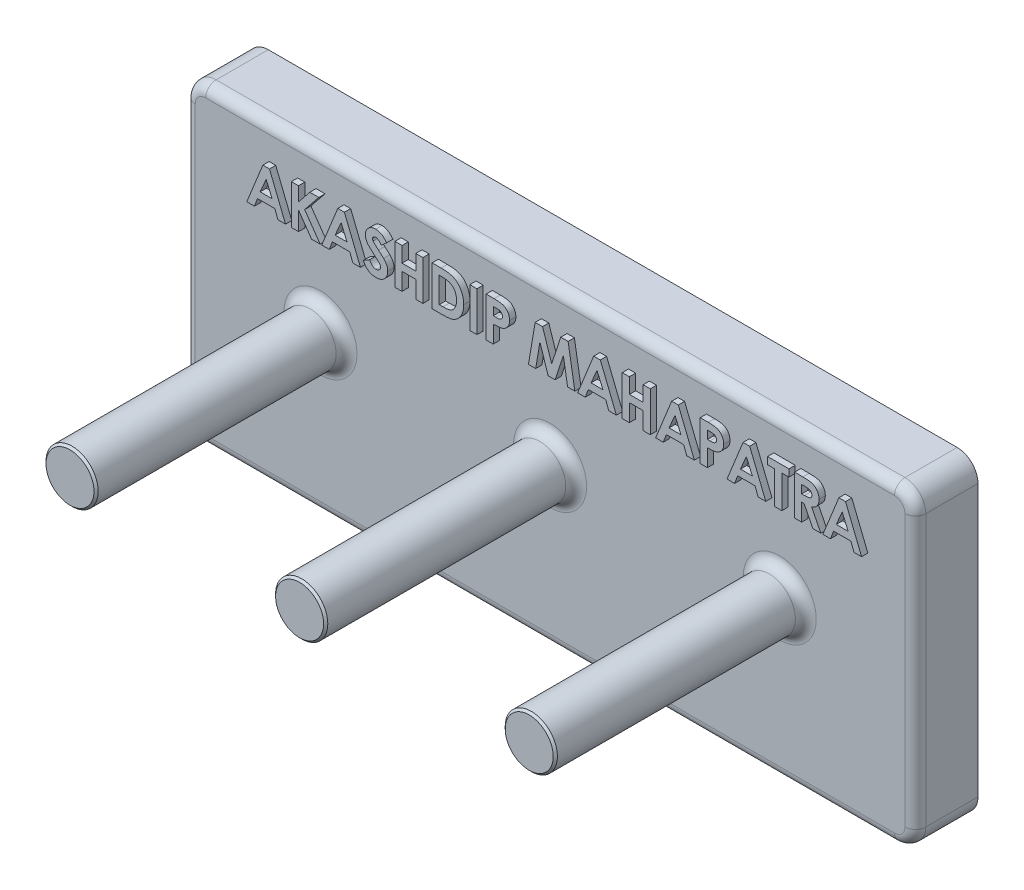
from build123d import *

# Parameters (mm, degrees)
SKETCH1_R           = 12.5
BOSS_EXTRUDE1_DEPTH = 30
SKETCH1_2_R         = 12.5
BOSS_EXTRUDE2_DEPTH = 150
FILLET1_R           = 5
CHAMFER1_SIZE       = 1
WRAP1_OUTLINE_W     = 3.419230769
WRAP1_OUTLINE_H     = 19.05
WRAP1_DEPTH         = 3


# Read off the part's stored shape, not the designer's step: Wrap1
with BuildPart() as part:
    # Sketch1 → Boss-Extrude1 (new body)
    with BuildSketch(Plane.XY):
        with BuildLine():
            Line((-165, 75), (165, 75))
            ThreePointArc((165, 75), (172.071067812, 72.071067812), (175, 65))
            Line((175, 65), (175, -65))
            ThreePointArc((175, -65), (172.071067812, -72.071067812), (165, -75))
            Line((165, -75), (-165, -75))
            ThreePointArc((-165, -75), (-172.071067812, -72.071067812), (-175, -65))
            Line((-175, -65), (-175, 65))
            ThreePointArc((-175, 65), (-172.071067812, 72.071067812), (-165, 75))
        make_face()
        with Locations((-110, 0)):
            Circle(SKETCH1_R, mode=Mode.SUBTRACT)
        Circle(SKETCH1_R, mode=Mode.SUBTRACT)
        with Locations((110, 0)):
            Circle(SKETCH1_R, mode=Mode.SUBTRACT)
    extrude(amount=BOSS_EXTRUDE1_DEPTH)

    # Sketch1<2> → Boss-Extrude2 (add)
    with BuildSketch(Plane.XY):
        with Locations((-110, 0)):
            Circle(SKETCH1_2_R)
        Circle(SKETCH1_2_R)
        with Locations((110, 0)):
            Circle(SKETCH1_2_R)
    extrude(amount=BOSS_EXTRUDE2_DEPTH)

    # Fillet1
    fillet1_edges = [part.edges().sort_by_distance(p)[0] for p in [
        (-172.071067812, 72.071067812, 30),
        (-175, 0, 30),
        (-172.071067812, -72.071067812, 30),
        (-122.5, 0, 30),
        (0, -75, 30),
        (-12.5, 0, 30),
        (172.071067812, -72.071067812, 30),
        (97.5, 0, 30),
        (175, 0, 30),
        (172.071067812, 72.071067812, 30),
        (0, 75, 30),
    ]]
    fillet(fillet1_edges, radius=FILLET1_R)

    # Chamfer1
    chamfer1_edges = [part.edges().sort_by_distance(p)[0] for p in [
        (-122.5, 0, 150),
        (-12.5, 0, 150),
        (97.5, 0, 150),
    ]]
    chamfer(chamfer1_edges, length=CHAMFER1_SIZE)

    # Wrap1 outline → Wrap1 (add)
    # profile 1 of 17: a face of its own
    with BuildSketch(Plane.XY.offset(30)):
        with BuildLine():
            add(Edge.make_bspline(
                [(-77.825171456, 53.916183611), (-77.934693413, 54.070675718), (-78.144960298, 54.367279018), (-78.485780987, 54.764437829), (-78.825062696, 55.10324385), (-79.165948663, 55.382281708), (-79.511460373, 55.599856039), (-79.860998066, 55.753901068), (-80.212580117, 55.851828956), (-80.448788984, 55.864023334), (-80.565135398, 55.870029764)],
                knots=[0, 0, 0, 0, 0.162420307, 0.31182434, 0.448432767, 0.573381197, 0.689077147, 0.797572901, 0.900293043, 1, 1, 1, 1], degree=3))
            Line((-77.825171456, 53.916183611), (-75.268380591, 56.255456447))
            add(Edge.make_bspline(
                [(-80.526974341, 59.289260534), (-80.302522437, 59.281049605), (-79.855390373, 59.264692561), (-79.194292722, 59.136785826), (-78.548560176, 58.935639012), (-78.028216789, 58.692977511), (-77.614189269, 58.4579112), (-77.29687585, 58.241491751), (-76.973992366, 57.993571641), (-76.642934963, 57.713369608), (-76.3098552, 57.395606277), (-75.965282025, 57.047846255), (-75.61391067, 56.667084082), (-75.385575, 56.395069351), (-75.268380591, 56.255456447)],
                knots=[0, 0, 0, 0, 0.10691022, 0.212976528, 0.319776676, 0.428556273, 0.485856803, 0.546558687, 0.611431498, 0.67982091, 0.753158505, 0.830752869, 0.913133075, 1, 1, 1, 1], degree=3))
            add(Edge.make_bspline(
                [(-85.526072898, 54.45807063), (-85.521940711, 54.62116651), (-85.513799859, 54.942482914), (-85.441182199, 55.414931869), (-85.332652339, 55.870805414), (-85.175035825, 56.308440314), (-84.97046862, 56.727288414), (-84.722029697, 57.129400152), (-84.425861269, 57.511074582), (-84.092099444, 57.872058682), (-83.724379366, 58.201957069), (-83.331423733, 58.493125451), (-82.915456707, 58.739050501), (-82.479022964, 58.943063187), (-82.019418107, 59.099221938), (-81.540028022, 59.209915044), (-81.040165113, 59.275751774), (-80.700169152, 59.284701514), (-80.526974341, 59.289260534)],
                knots=[0, 0, 0, 0, 0.06317288, 0.12445736, 0.184840915, 0.244566821, 0.304319173, 0.365199786, 0.427420983, 0.491261689, 0.555499002, 0.618604518, 0.680494764, 0.742473305, 0.804990665, 0.868251971, 0.932887217, 1, 1, 1, 1], degree=3))
            add(Edge.make_bspline(
                [(-80.725411841, 47.772253322), (-80.967886154, 47.977409842), (-81.433267752, 48.371167301), (-82.090910995, 48.952734672), (-82.683506441, 49.496262669), (-83.205935799, 50.008470485), (-83.664855629, 50.47989883), (-84.057157926, 50.914376825), (-84.37853307, 51.315255874), (-84.716711112, 51.790070281), (-85.038047866, 52.36866426), (-85.315774009, 53.064779892), (-85.495951009, 53.760807197), (-85.516137336, 54.228081593), (-85.526072898, 54.45807063)],
                knots=[0, 0, 0, 0, 0.112124581, 0.215201009, 0.309902452, 0.395959096, 0.473447494, 0.542140328, 0.602523333, 0.654726333, 0.747804055, 0.835278417, 0.918925243, 1, 1, 1, 1], degree=3))
            add(Edge.make_bspline(
                [(-78.199149821, 44.486586255), (-78.205422389, 44.595289709), (-78.21816451, 44.816110371), (-78.312019048, 45.144435186), (-78.458742317, 45.472610685), (-78.632326291, 45.741789109), (-78.808969721, 45.967164906), (-78.977880681, 46.162442839), (-79.183569549, 46.378190768), (-79.425514787, 46.614680088), (-79.700519668, 46.873992674), (-80.008815848, 47.156103134), (-80.353933644, 47.45852641), (-80.597863584, 47.664534158), (-80.725411841, 47.772253322)],
                knots=[0, 0, 0, 0, 0.076346606, 0.155090822, 0.238351561, 0.32840414, 0.37938386, 0.439617644, 0.509831416, 0.588874645, 0.677436354, 0.77554672, 0.882635872, 1, 1, 1, 1], degree=3))
            add(Edge.make_bspline(
                [(-80.37433011, 42.681568226), (-80.226072065, 42.687564162), (-79.938429864, 42.699197152), (-79.527857431, 42.806647573), (-79.151429079, 42.975352617), (-78.826047191, 43.216071449), (-78.550534324, 43.493897569), (-78.347190013, 43.80299183), (-78.219447746, 44.13742436), (-78.205942291, 44.369743194), (-78.199149821, 44.486586255)],
                knots=[0, 0, 0, 0, 0.141985893, 0.275473311, 0.404345843, 0.535429711, 0.661427401, 0.77786684, 0.888279749, 1, 1, 1, 1], degree=3))
            add(Edge.make_bspline(
                [(-83.495904629, 45.123875918), (-83.384876817, 44.930883015), (-83.172027012, 44.560899124), (-82.811333119, 44.063778875), (-82.441820639, 43.638077669), (-82.054946775, 43.291319805), (-81.655415769, 43.018868682), (-81.241297793, 42.824156208), (-80.812301896, 42.703629407), (-80.52008938, 42.688910301), (-80.37433011, 42.681568226)],
                knots=[0, 0, 0, 0, 0.160457921, 0.307611547, 0.442138888, 0.566229194, 0.681222208, 0.789558005, 0.895028892, 1, 1, 1, 1], degree=3))
            Line((-83.495904629, 45.123875918), (-86.502995975, 43.318857889))
            add(Edge.make_bspline(
                [(-80.5002616, 39.262337457), (-80.663189489, 39.265227906), (-80.985880148, 39.270952653), (-81.461477394, 39.31769045), (-81.920720298, 39.39312028), (-82.363091565, 39.50123376), (-82.790584155, 39.638228203), (-83.203215623, 39.805561666), (-83.59813744, 40.005827757), (-83.978337769, 40.234908207), (-84.341968369, 40.500900786), (-84.693627205, 40.798367361), (-85.029821267, 41.131883102), (-85.352165228, 41.500659256), (-85.658596642, 41.90574011), (-85.959146107, 42.341484163), (-86.240456301, 42.815978233), (-86.414234122, 43.148839661), (-86.502995975, 43.318857889)],
                knots=[0, 0, 0, 0, 0.063551482, 0.125868382, 0.18624025, 0.244976651, 0.303357688, 0.361230317, 0.418489049, 0.475936712, 0.534203744, 0.594059429, 0.655468694, 0.718771685, 0.784974607, 0.853522316, 0.925182451, 1, 1, 1, 1], degree=3))
            add(Edge.make_bspline(
                [(-74.779919052, 44.685023755), (-74.78332903, 44.492627347), (-74.790019535, 44.115138433), (-74.871965383, 43.562739638), (-74.988815353, 43.034070016), (-75.169485906, 42.534882241), (-75.389686105, 42.056982298), (-75.665738858, 41.607814347), (-75.989924965, 41.182832626), (-76.361492019, 40.789634203), (-76.772489302, 40.432833888), (-77.213322949, 40.11520182), (-77.688303653, 39.852956089), (-78.193373254, 39.637015435), (-78.728261398, 39.470695056), (-79.292330874, 39.347768795), (-79.886444464, 39.273990391), (-80.292707898, 39.266277734), (-80.5002616, 39.262337457)],
                knots=[0, 0, 0, 0, 0.065200875, 0.127926544, 0.18904691, 0.248543693, 0.307607127, 0.36724766, 0.426963056, 0.488617128, 0.550391855, 0.611330734, 0.672556085, 0.734024191, 0.797340621, 0.862249627, 0.929625466, 1, 1, 1, 1], degree=3))
            add(Edge.make_bspline(
                [(-76.749029629, 49.054464861), (-76.580847605, 48.872455891), (-76.257542692, 48.522570733), (-75.837360277, 47.980358776), (-75.491536558, 47.451049345), (-75.224000772, 46.924682627), (-75.021946985, 46.393664197), (-74.879496389, 45.844970857), (-74.794181779, 45.272869106), (-74.784709866, 44.8824795), (-74.779919052, 44.685023755)],
                knots=[0, 0, 0, 0, 0.150833097, 0.289954183, 0.417138648, 0.535255184, 0.648751095, 0.762405462, 0.879826701, 1, 1, 1, 1], degree=3))
            add(Edge.make_bspline(
                [(-79.202785639, 51.252541784), (-79.042538941, 51.11385635), (-78.738424002, 50.850660209), (-78.305728834, 50.477095547), (-77.925461847, 50.141008528), (-77.592083417, 49.847443101), (-77.310647237, 49.593319092), (-77.079970148, 49.377421791), (-76.897234819, 49.203954322), (-76.793360485, 49.099179865), (-76.749029629, 49.054464861)],
                knots=[0, 0, 0, 0, 0.192952702, 0.366184141, 0.520457298, 0.655012135, 0.770624226, 0.865677185, 0.942674527, 1, 1, 1, 1], degree=3))
            add(Edge.make_bspline(
                [(-81.79010535, 53.710113899), (-81.746294636, 53.654804936), (-81.645448157, 53.527491009), (-81.453154577, 53.325845593), (-81.211674226, 53.078812309), (-80.91171443, 52.794885906), (-80.565727347, 52.463855282), (-80.157676028, 52.098733375), (-79.699305969, 51.688212786), (-79.373507151, 51.402341113), (-79.202785639, 51.252541784)],
                knots=[0, 0, 0, 0, 0.059234189, 0.136349281, 0.233805212, 0.349411224, 0.48317915, 0.635966856, 0.809243356, 1, 1, 1, 1], degree=3))
            add(Edge.make_bspline(
                [(-82.106842129, 54.622163178), (-82.103476826, 54.542871703), (-82.096699574, 54.383189691), (-82.031240542, 54.149155816), (-81.932575089, 53.920477477), (-81.838296221, 53.78127009), (-81.79010535, 53.710113899)],
                knots=[0, 0, 0, 0, 0.241881375, 0.487115475, 0.73783784, 1, 1, 1, 1], degree=3))
            add(Edge.make_bspline(
                [(-80.565135398, 55.870029764), (-80.673659997, 55.866223814), (-80.883192483, 55.858875525), (-81.181896588, 55.785834075), (-81.447090346, 55.65977526), (-81.67851494, 55.494942753), (-81.861837362, 55.296357797), (-82.0082061, 55.088093239), (-82.090623999, 54.858216267), (-82.101471816, 54.700327489), (-82.106842129, 54.622163178)],
                knots=[0, 0, 0, 0, 0.148126258, 0.285992887, 0.416634394, 0.547379946, 0.671582838, 0.784400739, 0.893265576, 1, 1, 1, 1], degree=3))
        make_face()
    # profile 2 of 17: a face of its own
    with BuildSketch(Plane.XY.offset(30)):
        with BuildLine():
            add(Edge.make_bspline(
                [(-49.223458716, 58.800798995), (-48.887570673, 58.798451023), (-48.23829529, 58.793912366), (-47.297623708, 58.742772615), (-46.42291884, 58.664123308), (-45.613616833, 58.555926933), (-44.871376887, 58.412753501), (-44.197156105, 58.233170491), (-43.588691642, 58.025871782), (-43.03931181, 57.781942786), (-42.537780864, 57.497545802), (-42.061561225, 57.180750394), (-41.611587938, 56.819951421), (-41.18154634, 56.422109413), (-40.776986209, 55.979945975), (-40.391170169, 55.500784933), (-40.033544749, 54.977677792), (-39.693299704, 54.423167012), (-39.385593336, 53.834902629), (-39.117200344, 53.217891827), (-38.892365907, 52.576105299), (-38.709676284, 51.908859069), (-38.56405157, 51.218368191), (-38.462160893, 50.503239319), (-38.399171061, 49.764134543), (-38.392781269, 49.263206946), (-38.389534437, 49.008671591)],
                knots=[0, 0, 0, 0, 0.060148162, 0.116267077, 0.168653955, 0.217398969, 0.262433523, 0.303932701, 0.342259967, 0.377441339, 0.411406099, 0.445398351, 0.479766387, 0.514584482, 0.550213651, 0.587000908, 0.624662987, 0.663615456, 0.703456428, 0.743450162, 0.784013386, 0.825132536, 0.867264663, 0.910306473, 0.954424205, 1, 1, 1, 1], degree=3))
            Line((-49.223458716, 58.800798995), (-53.531842129, 58.800798995))
            Line((-53.531842129, 58.800798995), (-53.531842129, 39.750798995))
            Line((-53.531842129, 39.750798995), (-49.158584918, 39.750798995))
            add(Edge.make_bspline(
                [(-38.389534437, 49.008671591), (-38.398036397, 48.649505637), (-38.414773002, 47.942466433), (-38.555752819, 46.904894546), (-38.783764918, 45.910278406), (-39.104370638, 44.966398288), (-39.501835908, 44.081659581), (-39.97665268, 43.271664283), (-40.521859035, 42.540760037), (-41.131103287, 41.892586148), (-41.79076643, 41.335471906), (-42.476289459, 40.858344328), (-43.194350615, 40.482089419), (-43.827062845, 40.243487541), (-44.375703284, 40.095097817), (-44.857403654, 40.00739806), (-45.404566125, 39.926972095), (-46.022292512, 39.864820638), (-46.707872982, 39.809396813), (-47.464040268, 39.779281663), (-48.288346118, 39.754260444), (-48.860904469, 39.751983045), (-49.158584918, 39.750798995)],
                knots=[0, 0, 0, 0, 0.065772947, 0.129477895, 0.191430088, 0.252445668, 0.311786958, 0.36881755, 0.424091518, 0.478492106, 0.531393744, 0.58200397, 0.631201271, 0.679503008, 0.705561374, 0.735221723, 0.769132486, 0.80685832, 0.848929771, 0.895116661, 0.945469804, 1, 1, 1, 1], degree=3))
        make_face()
        with BuildLine():
            add(Edge.make_bspline(
                [(-48.32667386, 43.170029764), (-48.114174725, 43.170419151), (-47.705468148, 43.171168071), (-47.115388365, 43.20683976), (-46.569714185, 43.2426443), (-46.069947722, 43.310602514), (-45.61245183, 43.386303181), (-45.203511304, 43.491651026), (-44.834696105, 43.602310013), (-44.510511238, 43.743192618), (-44.213584313, 43.901765367), (-43.938663897, 44.087551725), (-43.673288724, 44.293860469), (-43.422420197, 44.526759433), (-43.185108839, 44.783164597), (-42.962758733, 45.064397102), (-42.752402094, 45.3695989), (-42.55943838, 45.700383669), (-42.383107105, 46.053258247), (-42.226681505, 46.424804529), (-42.0969816, 46.818116696), (-41.98918298, 47.229512871), (-41.912148643, 47.662574726), (-41.848417421, 48.114094633), (-41.81556212, 48.585861475), (-41.811052934, 48.9068674), (-41.808765206, 49.069729284)],
                knots=[0, 0, 0, 0, 0.062614648, 0.120428813, 0.174199486, 0.223724664, 0.26902845, 0.310765001, 0.348115258, 0.382378114, 0.414753161, 0.447195432, 0.480044579, 0.513738641, 0.547962504, 0.582917814, 0.619315101, 0.657123545, 0.695686576, 0.735513716, 0.7758232, 0.817652262, 0.860742584, 0.905386927, 0.951998197, 1, 1, 1, 1], degree=3))
            Line((-48.32667386, 43.170029764), (-50.11261136, 43.170029764))
            Line((-50.11261136, 43.170029764), (-50.11261136, 55.381568226))
            Line((-50.11261136, 55.381568226), (-48.807503187, 55.381568226))
            add(Edge.make_bspline(
                [(-43.606151023, 53.855125918), (-43.747840537, 53.979138536), (-44.037225326, 54.232420264), (-44.545289918, 54.535916547), (-45.105150784, 54.80256778), (-45.729615865, 55.01399247), (-46.41264998, 55.181196128), (-47.158321296, 55.296512403), (-47.962636582, 55.370613418), (-48.519847471, 55.377838391), (-48.807503187, 55.381568226)],
                knots=[0, 0, 0, 0, 0.101663476, 0.207636138, 0.318744567, 0.436679942, 0.563506646, 0.698681208, 0.844446556, 1, 1, 1, 1], degree=3))
            add(Edge.make_bspline(
                [(-41.808765206, 49.069729284), (-41.813321585, 49.319299724), (-41.82220617, 49.805942745), (-41.907887187, 50.514748926), (-42.047359537, 51.182196131), (-42.246373144, 51.805807281), (-42.497235963, 52.387335054), (-42.811249259, 52.921852676), (-43.174899109, 53.418339307), (-43.462463489, 53.709594295), (-43.606151023, 53.855125918)],
                knots=[0, 0, 0, 0, 0.142276686, 0.277428514, 0.406477152, 0.530595072, 0.650142922, 0.766850697, 0.883502093, 1, 1, 1, 1], degree=3))
        make_face(mode=Mode.SUBTRACT)
    # profile 3 of 17: a face of its own
    with BuildSketch(Plane.XY.offset(30)):
        with BuildLine():
            add(Edge.make_bspline(
                [(-23.827274821, 58.800798995), (-23.577935421, 58.799682899), (-23.096907453, 58.797529715), (-22.403225547, 58.771419501), (-21.763270024, 58.724628405), (-21.177187913, 58.666802011), (-20.645220197, 58.585731656), (-20.166700692, 58.492790841), (-19.741530094, 58.379561879), (-19.364913972, 58.245160671), (-19.026913168, 58.086706898), (-18.707055392, 57.917942318), (-18.412569465, 57.716527745), (-18.128591792, 57.504170785), (-17.871357868, 57.260585059), (-17.6248199, 57.001981552), (-17.399419444, 56.718104261), (-17.194112076, 56.412389443), (-17.007866658, 56.090485402), (-16.845150202, 55.751816668), (-16.713163725, 55.395847335), (-16.602443482, 55.024880117), (-16.513511905, 54.638931184), (-16.454316216, 54.235626915), (-16.414107526, 53.817783333), (-16.410559664, 53.533398728), (-16.408765206, 53.389561014)],
                knots=[0, 0, 0, 0, 0.070781161, 0.136551696, 0.197012482, 0.252922694, 0.303686532, 0.349719151, 0.391240471, 0.428478555, 0.463056565, 0.497150358, 0.531002334, 0.564226377, 0.59770067, 0.631421421, 0.665597347, 0.700451436, 0.735880684, 0.771092108, 0.806974845, 0.843534403, 0.880940196, 0.919294384, 0.95918024, 1, 1, 1, 1], degree=3))
            Line((-23.827274821, 58.800798995), (-27.643380591, 58.800798995))
            Line((-27.643380591, 58.800798995), (-27.643380591, 39.750798995))
            Line((-27.643380591, 39.750798995), (-24.224149821, 39.750798995))
            Line((-24.224149821, 39.750798995), (-24.224149821, 48.054645149))
            add(Edge.make_bspline(
                [(-20.343170254, 48.344669188), (-20.440827199, 48.320371982), (-20.65238359, 48.267736409), (-21.00245131, 48.214298092), (-21.405867601, 48.165164845), (-21.863936974, 48.122940768), (-22.376923514, 48.094238233), (-22.944330518, 48.071822831), (-23.566415126, 48.055524518), (-23.998988162, 48.054946183), (-24.224149821, 48.054645149)],
                knots=[0, 0, 0, 0, 0.077372749, 0.167614291, 0.272108317, 0.390015992, 0.52136331, 0.667272254, 0.826809521, 1, 1, 1, 1], degree=3))
            add(Edge.make_bspline(
                [(-16.408765206, 53.389561014), (-16.411361562, 53.230436777), (-16.416463722, 52.917738095), (-16.466481328, 52.459360192), (-16.551927201, 52.022338362), (-16.663600487, 51.602987123), (-16.819320944, 51.20820573), (-16.997224253, 50.828574581), (-17.216101753, 50.474737365), (-17.466204287, 50.142268007), (-17.739344787, 49.828463373), (-18.042007597, 49.542383979), (-18.368423834, 49.282079632), (-18.71670399, 49.04482232), (-19.088155614, 48.831090646), (-19.482510685, 48.638883239), (-19.902462084, 48.474347489), (-20.194903603, 48.388296623), (-20.343170254, 48.344669188)],
                knots=[0, 0, 0, 0, 0.068875425, 0.135348675, 0.199289315, 0.26155008, 0.322915384, 0.382771997, 0.442843572, 0.502652029, 0.562748843, 0.622739582, 0.682687332, 0.743329247, 0.805012514, 0.86806712, 0.933110571, 1, 1, 1, 1], degree=3))
        make_face()
        with BuildLine():
            add(Edge.make_bspline(
                [(-23.014444293, 51.473875918), (-22.794319273, 51.475271682), (-22.389285967, 51.477839907), (-21.836153501, 51.514977941), (-21.391645612, 51.571695221), (-21.040476125, 51.653040917), (-20.763194554, 51.776493781), (-20.524056558, 51.919305498), (-20.318941794, 52.099886993), (-20.141342598, 52.30623225), (-19.999357393, 52.543333292), (-19.900898049, 52.807329389), (-19.836940795, 53.092673701), (-19.831033749, 53.291254456), (-19.827995975, 53.39337712)],
                knots=[0, 0, 0, 0, 0.155159592, 0.285495954, 0.390502806, 0.470975045, 0.538445527, 0.60365534, 0.666587169, 0.73019895, 0.794944675, 0.860228437, 0.928120706, 1, 1, 1, 1], degree=3))
            Line((-23.014444293, 51.473875918), (-24.224149821, 51.473875918))
            Line((-24.224149821, 51.473875918), (-24.224149821, 55.381568226))
            Line((-24.224149821, 55.381568226), (-23.148007994, 55.381568226))
            add(Edge.make_bspline(
                [(-20.724780831, 55.003773755), (-20.785255293, 55.034357424), (-20.913292121, 55.09910932), (-21.131351252, 55.174388132), (-21.38298816, 55.237894104), (-21.669901677, 55.290603447), (-21.990947222, 55.331511371), (-22.346067517, 55.362795699), (-22.735785153, 55.375376346), (-23.00681045, 55.379447339), (-23.148007994, 55.381568226)],
                knots=[0, 0, 0, 0, 0.08210116, 0.173824981, 0.278953094, 0.396639095, 0.527315592, 0.671298143, 0.82875438, 1, 1, 1, 1], degree=3))
            add(Edge.make_bspline(
                [(-19.827995975, 53.39337712), (-19.831002501, 53.482600362), (-19.836835884, 53.655714903), (-19.879689501, 53.905562125), (-19.94798584, 54.138471277), (-20.04694461, 54.352009932), (-20.174874867, 54.545815252), (-20.33084774, 54.719810892), (-20.512861789, 54.877723115), (-20.653387277, 54.961308467), (-20.724780831, 55.003773755)],
                knots=[0, 0, 0, 0, 0.137787685, 0.267341238, 0.390444331, 0.511777883, 0.629508981, 0.747829066, 0.87188531, 1, 1, 1, 1], degree=3))
        make_face(mode=Mode.SUBTRACT)
    # profile 4 of 17: a face of its own
    with BuildSketch(Plane.XY.offset(30)):
        with BuildLine():
            add(Edge.make_bspline(
                [(78.749648256, 58.800798995), (78.998987656, 58.799682899), (79.480015624, 58.797529715), (80.17369753, 58.771419501), (80.813653053, 58.724628405), (81.399735163, 58.666802011), (81.93170288, 58.585731656), (82.410222385, 58.492790841), (82.835392983, 58.379561879), (83.212009105, 58.245160671), (83.550009909, 58.086706898), (83.869867685, 57.917942318), (84.164353612, 57.716527745), (84.448331284, 57.504170785), (84.705565208, 57.260585059), (84.952103177, 57.001981552), (85.177503633, 56.718104261), (85.382811001, 56.412389443), (85.569056418, 56.090485402), (85.731772875, 55.751816668), (85.863759352, 55.395847335), (85.974479595, 55.024880117), (86.063411172, 54.638931184), (86.122606861, 54.235626915), (86.162815551, 53.817783333), (86.166363413, 53.533398728), (86.168157871, 53.389561014)],
                knots=[0, 0, 0, 0, 0.070781161, 0.136551696, 0.197012482, 0.252922694, 0.303686532, 0.349719151, 0.391240471, 0.428478555, 0.463056565, 0.497150358, 0.531002334, 0.564226377, 0.59770067, 0.631421421, 0.665597347, 0.700451436, 0.735880684, 0.771092108, 0.806974845, 0.843534403, 0.880940196, 0.919294384, 0.95918024, 1, 1, 1, 1], degree=3))
            Line((78.749648256, 58.800798995), (74.933542486, 58.800798995))
            Line((74.933542486, 58.800798995), (74.933542486, 39.750798995))
            Line((74.933542486, 39.750798995), (78.352773256, 39.750798995))
            Line((78.352773256, 39.750798995), (78.352773256, 48.054645149))
            add(Edge.make_bspline(
                [(82.233752823, 48.344669188), (82.136095878, 48.320371982), (81.924539487, 48.267736409), (81.574471767, 48.214298092), (81.171055476, 48.165164845), (80.712986103, 48.122940768), (80.199999563, 48.094238233), (79.632592559, 48.071822831), (79.010507951, 48.055524518), (78.577934915, 48.054946183), (78.352773256, 48.054645149)],
                knots=[0, 0, 0, 0, 0.077372749, 0.167614291, 0.272108317, 0.390015992, 0.52136331, 0.667272254, 0.826809521, 1, 1, 1, 1], degree=3))
            add(Edge.make_bspline(
                [(86.168157871, 53.389561014), (86.165561514, 53.230436777), (86.160459355, 52.917738095), (86.110441749, 52.459360192), (86.024995876, 52.022338362), (85.913322589, 51.602987123), (85.757602133, 51.20820573), (85.579698824, 50.828574581), (85.360821324, 50.474737365), (85.11071879, 50.142268007), (84.837578289, 49.828463373), (84.534915479, 49.542383979), (84.208499243, 49.282079632), (83.860219087, 49.04482232), (83.488767463, 48.831090646), (83.094412392, 48.638883239), (82.674460993, 48.474347489), (82.382019474, 48.388296623), (82.233752823, 48.344669188)],
                knots=[0, 0, 0, 0, 0.068875425, 0.135348675, 0.199289315, 0.26155008, 0.322915384, 0.382771997, 0.442843572, 0.502652029, 0.562748843, 0.622739582, 0.682687332, 0.743329247, 0.805012514, 0.86806712, 0.933110571, 1, 1, 1, 1], degree=3))
        make_face()
        with BuildLine():
            add(Edge.make_bspline(
                [(79.562478784, 51.473875918), (79.782603804, 51.475271682), (80.18763711, 51.477839907), (80.740769576, 51.514977941), (81.185277465, 51.571695221), (81.536446952, 51.653040917), (81.813728523, 51.776493781), (82.052866519, 51.919305498), (82.257981283, 52.099886993), (82.435580479, 52.30623225), (82.577565684, 52.543333292), (82.676025028, 52.807329389), (82.739982282, 53.092673701), (82.745889328, 53.291254456), (82.748927102, 53.39337712)],
                knots=[0, 0, 0, 0, 0.155159592, 0.285495954, 0.390502806, 0.470975045, 0.538445527, 0.60365534, 0.666587169, 0.73019895, 0.794944675, 0.860228437, 0.928120706, 1, 1, 1, 1], degree=3))
            Line((79.562478784, 51.473875918), (78.352773256, 51.473875918))
            Line((78.352773256, 51.473875918), (78.352773256, 55.381568226))
            Line((78.352773256, 55.381568226), (79.428915082, 55.381568226))
            add(Edge.make_bspline(
                [(81.852142246, 55.003773755), (81.791667784, 55.034357424), (81.663630956, 55.09910932), (81.445571825, 55.174388132), (81.193934917, 55.237894104), (80.9070214, 55.290603447), (80.585975855, 55.331511371), (80.23085556, 55.362795699), (79.841137924, 55.375376346), (79.570112627, 55.379447339), (79.428915082, 55.381568226)],
                knots=[0, 0, 0, 0, 0.08210116, 0.173824981, 0.278953094, 0.396639095, 0.527315592, 0.671298143, 0.82875438, 1, 1, 1, 1], degree=3))
            add(Edge.make_bspline(
                [(82.748927102, 53.39337712), (82.745920576, 53.482600362), (82.740087193, 53.655714903), (82.697233576, 53.905562125), (82.628937237, 54.138471277), (82.529978467, 54.352009932), (82.40204821, 54.545815252), (82.246075337, 54.719810892), (82.064061288, 54.877723115), (81.9235358, 54.961308467), (81.852142246, 55.003773755)],
                knots=[0, 0, 0, 0, 0.137787685, 0.267341238, 0.390444331, 0.511777883, 0.629508981, 0.747829066, 0.87188531, 1, 1, 1, 1], degree=3))
        make_face(mode=Mode.SUBTRACT)
    # profile 5 of 17: a face of its own
    with BuildSketch(Plane.XY.offset(30)):
        with BuildLine():
            add(Edge.make_bspline(
                [(124.100249217, 58.800798995), (124.363591358, 58.799864282), (124.870072474, 58.798066564), (125.60039058, 58.769703348), (126.271288195, 58.730233603), (126.883758644, 58.670001726), (127.437539903, 58.590141538), (127.933186989, 58.49599959), (128.370685415, 58.388704658), (128.753724876, 58.255006707), (129.099399049, 58.104197445), (129.421615436, 57.930914838), (129.72748261, 57.737088442), (130.014956179, 57.517618161), (130.286534356, 57.27645221), (130.542729489, 57.013347832), (130.779921304, 56.72607401), (130.9966411, 56.416445951), (131.194163749, 56.090724334), (131.368732343, 55.748461939), (131.510691814, 55.389420747), (131.636128224, 55.018789679), (131.726476007, 54.631270491), (131.789311568, 54.230635748), (131.835317308, 53.815475173), (131.837962418, 53.533433511), (131.839311717, 53.389561014)],
                knots=[0, 0, 0, 0, 0.072889027, 0.14018613, 0.202277434, 0.258895132, 0.310482942, 0.357095244, 0.398513567, 0.435037511, 0.469251486, 0.502805028, 0.536210446, 0.56937936, 0.602801475, 0.636665798, 0.670928657, 0.705803, 0.741189061, 0.776304311, 0.812004301, 0.847968976, 0.884521761, 0.921974159, 0.960198176, 1, 1, 1, 1], degree=3))
            Line((124.100249217, 58.800798995), (120.116234794, 58.800798995))
            Line((120.116234794, 58.800798995), (120.116234794, 39.750798995))
            Line((120.116234794, 39.750798995), (123.535465563, 39.750798995))
            Line((123.535465563, 39.750798995), (123.535465563, 48.054645149))
            Line((123.535465563, 48.054645149), (124.695561717, 48.054645149))
            Line((124.695561717, 48.054645149), (128.893278063, 39.750798995))
            Line((128.893278063, 39.750798995), (132.694119409, 39.750798995))
            Line((132.694119409, 39.750798995), (128.297965563, 48.443887938))
            add(Edge.make_bspline(
                [(131.839311717, 53.389561014), (131.835806723, 53.239391178), (131.828934068, 52.9449355), (131.791914211, 52.512404123), (131.724253542, 52.098588357), (131.621771614, 51.704699802), (131.50398195, 51.325836056), (131.347351911, 50.968987392), (131.170579432, 50.628963963), (130.960631922, 50.31057553), (130.730224788, 50.006750049), (130.462266137, 49.729128202), (130.174115574, 49.462788865), (129.849575107, 49.224414632), (129.502950782, 48.997887497), (129.127355537, 48.792593586), (128.725240635, 48.603372284), (128.442533946, 48.497849414), (128.297965563, 48.443887938)],
                knots=[0, 0, 0, 0, 0.068741263, 0.134789088, 0.19853605, 0.260385651, 0.320961578, 0.37990385, 0.438502936, 0.496154344, 0.554265483, 0.612748761, 0.672513443, 0.733646402, 0.796789619, 0.861935699, 0.929397735, 1, 1, 1, 1], degree=3))
        make_face()
        with BuildLine():
            add(Edge.make_bspline(
                [(124.867286477, 51.473875918), (125.030112654, 51.475709776), (125.341889797, 51.47922122), (125.790266278, 51.495508751), (126.197499054, 51.534753654), (126.565336921, 51.584338122), (126.895630806, 51.641590551), (127.185434604, 51.723636758), (127.439213748, 51.811551345), (127.653960947, 51.920806372), (127.837436019, 52.045053034), (127.995855001, 52.18620033), (128.126890213, 52.349560353), (128.234738877, 52.530693682), (128.318633412, 52.731202397), (128.379869995, 52.948885365), (128.41409219, 53.186222277), (128.41802957, 53.350017063), (128.420080948, 53.435354284)],
                knots=[0, 0, 0, 0, 0.105539996, 0.202086415, 0.290684899, 0.37055261, 0.442670262, 0.507674928, 0.565573203, 0.616454666, 0.663331357, 0.708862024, 0.7534118, 0.798515011, 0.845064321, 0.893873119, 0.944707806, 1, 1, 1, 1], degree=3))
            Line((124.867286477, 51.473875918), (123.535465563, 51.473875918))
            Line((123.535465563, 51.473875918), (123.535465563, 55.381568226))
            Line((123.535465563, 55.381568226), (124.699377823, 55.381568226))
            add(Edge.make_bspline(
                [(128.420080948, 53.435354284), (128.416202629, 53.536314446), (128.408584391, 53.734631975), (128.3329878, 54.020139679), (128.212654356, 54.284396592), (128.047710164, 54.526208738), (127.839984398, 54.738197957), (127.601602692, 54.925068143), (127.327420194, 55.072831103), (127.073547833, 55.170293978), (126.842583326, 55.228607022), (126.634145144, 55.272061386), (126.392772475, 55.302858741), (126.118283096, 55.335524819), (125.811376688, 55.356707116), (125.470380429, 55.372165971), (125.096273657, 55.378490948), (124.835485706, 55.380512932), (124.699377823, 55.381568226)],
                knots=[0, 0, 0, 0, 0.06376896, 0.125262305, 0.185413583, 0.246806762, 0.309422389, 0.372532682, 0.437733251, 0.505749517, 0.544013263, 0.588369599, 0.640389019, 0.697897401, 0.763271619, 0.834978604, 0.913873656, 1, 1, 1, 1], degree=3))
        make_face(mode=Mode.SUBTRACT)
    # profile 6 of 17: a face of its own
    with BuildSketch(Plane.XY.offset(30)):
        Polygon((-127.400201504, 39.750798995), (-123.748188283, 39.750798995), (-131.441457514, 58.800798995), (-134.612641408, 58.800798995), (-142.309726744, 39.750798995), (-138.661529629, 39.750798995), (-137.180880591, 43.658491303), (-128.880850543, 43.658491303), align=None)
        Polygon((-133.028957514, 53.69103337), (-130.174510398, 47.077722072), (-135.883404629, 47.077722072), align=None, mode=Mode.SUBTRACT)
    # profile 7 of 17: a face of its own
    with BuildSketch(Plane.XY.offset(30)):
        Polygon((-117.520303668, 48.684302601), (-111.2580741, 39.750798995), (-107.140495975, 39.750798995), (-114.589534437, 50.374837457), (-107.800682273, 58.800798995), (-112.116697898, 58.800798995), (-117.520303668, 52.095901159), (-117.520303668, 58.800798995), (-120.939534437, 58.800798995), (-120.939534437, 39.750798995), (-117.520303668, 39.750798995), align=None)
    # profile 8 of 17: a face of its own
    with BuildSketch(Plane.XY.offset(30)):
        Polygon((-92.978927466, 43.658491303), (-91.498278427, 39.750798995), (-87.846265206, 39.750798995), (-95.539534437, 58.800798995), (-98.710718331, 58.800798995), (-106.407803668, 39.750798995), (-102.759606552, 39.750798995), (-101.278957514, 43.658491303), align=None)
        Polygon((-97.127034437, 53.69103337), (-94.272587321, 47.077722072), (-99.981481552, 47.077722072), align=None, mode=Mode.SUBTRACT)
    # profile 9 of 17: a face of its own
    with BuildSketch(Plane.XY.offset(30)):
        Polygon((-61.347226744, 48.054645149), (-61.347226744, 39.750798995), (-57.927995975, 39.750798995), (-57.927995975, 58.800798995), (-61.347226744, 58.800798995), (-61.347226744, 51.473875918), (-67.941457514, 51.473875918), (-67.941457514, 58.800798995), (-71.360688283, 58.800798995), (-71.360688283, 39.750798995), (-67.941457514, 39.750798995), (-67.941457514, 48.054645149), align=None)
    # profile 10 of 17: a face of its own
    with BuildSketch(Plane.XY.offset(30)):
        with Locations((-33.749149821, 49.275798995)):
            Rectangle(WRAP1_OUTLINE_W, WRAP1_OUTLINE_H)
    # profile 11 of 17: a face of its own
    with BuildSketch(Plane.XY.offset(30)):
        Polygon((9.357580948, 51.782980486), (11.391565323, 39.750798995), (14.852773256, 39.750798995), (11.631979986, 58.800798995), (8.117346573, 58.800798995), (3.740273256, 45.513118707), (-0.606271216, 58.800798995), (-4.155249581, 58.800798995), (-7.372226744, 39.750798995), (-3.907202706, 39.750798995), (-1.877034437, 51.782980486), (2.061186717, 39.750798995), (5.396463159, 39.750798995), align=None)
    # profile 12 of 17: a face of its own
    with BuildSketch(Plane.XY.offset(30)):
        Polygon((29.624918688, 43.658491303), (31.105567727, 39.750798995), (34.757580948, 39.750798995), (27.064311717, 58.800798995), (23.893127823, 58.800798995), (16.196042486, 39.750798995), (19.844239602, 39.750798995), (21.32488864, 43.658491303), align=None)
        Polygon((25.476811717, 53.69103337), (28.331258832, 47.077722072), (22.622364602, 47.077722072), align=None, mode=Mode.SUBTRACT)
    # profile 13 of 17: a face of its own
    with BuildSketch(Plane.XY.offset(30)):
        Polygon((47.579696332, 48.054645149), (47.579696332, 39.750798995), (50.998927102, 39.750798995), (50.998927102, 58.800798995), (47.579696332, 58.800798995), (47.579696332, 51.473875918), (40.985465563, 51.473875918), (40.985465563, 58.800798995), (37.566234794, 58.800798995), (37.566234794, 39.750798995), (40.985465563, 39.750798995), (40.985465563, 48.054645149), align=None)
    # profile 14 of 17: a face of its own
    with BuildSketch(Plane.XY.offset(30)):
        Polygon((66.992226381, 43.658491303), (68.472875419, 39.750798995), (72.12488864, 39.750798995), (64.431619409, 58.800798995), (61.260435515, 58.800798995), (53.563350179, 39.750798995), (57.211547294, 39.750798995), (58.692196332, 43.658491303), align=None)
        Polygon((62.844119409, 53.69103337), (65.698566525, 47.077722072), (59.989672294, 47.077722072), align=None, mode=Mode.SUBTRACT)
    # profile 15 of 17: a face of its own
    with BuildSketch(Plane.XY.offset(30)):
        Polygon((101.184534073, 43.658491303), (102.665183111, 39.750798995), (106.317196332, 39.750798995), (98.623927102, 58.800798995), (95.452743207, 58.800798995), (87.755657871, 39.750798995), (91.403854986, 39.750798995), (92.884504025, 43.658491303), align=None)
        Polygon((97.036427102, 53.69103337), (99.890874217, 47.077722072), (94.181979986, 47.077722072), align=None, mode=Mode.SUBTRACT)
    # profile 16 of 17: a face of its own
    with BuildSketch(Plane.XY.offset(30)):
        Polygon((110.591234794, 55.381568226), (110.591234794, 39.750798995), (114.010465563, 39.750798995), (114.010465563, 55.381568226), (117.429696332, 55.381568226), (117.429696332, 58.800798995), (107.172004025, 58.800798995), (107.172004025, 55.381568226), align=None)
    # profile 17 of 17: a face of its own
    with BuildSketch(Plane.XY.offset(30)):
        Polygon((147.099918688, 43.658491303), (148.580567727, 39.750798995), (152.232580948, 39.750798995), (144.539311717, 58.800798995), (141.368127823, 58.800798995), (133.671042486, 39.750798995), (137.319239602, 39.750798995), (138.79988864, 43.658491303), align=None)
        Polygon((142.951811717, 53.69103337), (145.806258832, 47.077722072), (140.097364602, 47.077722072), align=None, mode=Mode.SUBTRACT)
    extrude(amount=WRAP1_DEPTH)


solid = part.part
